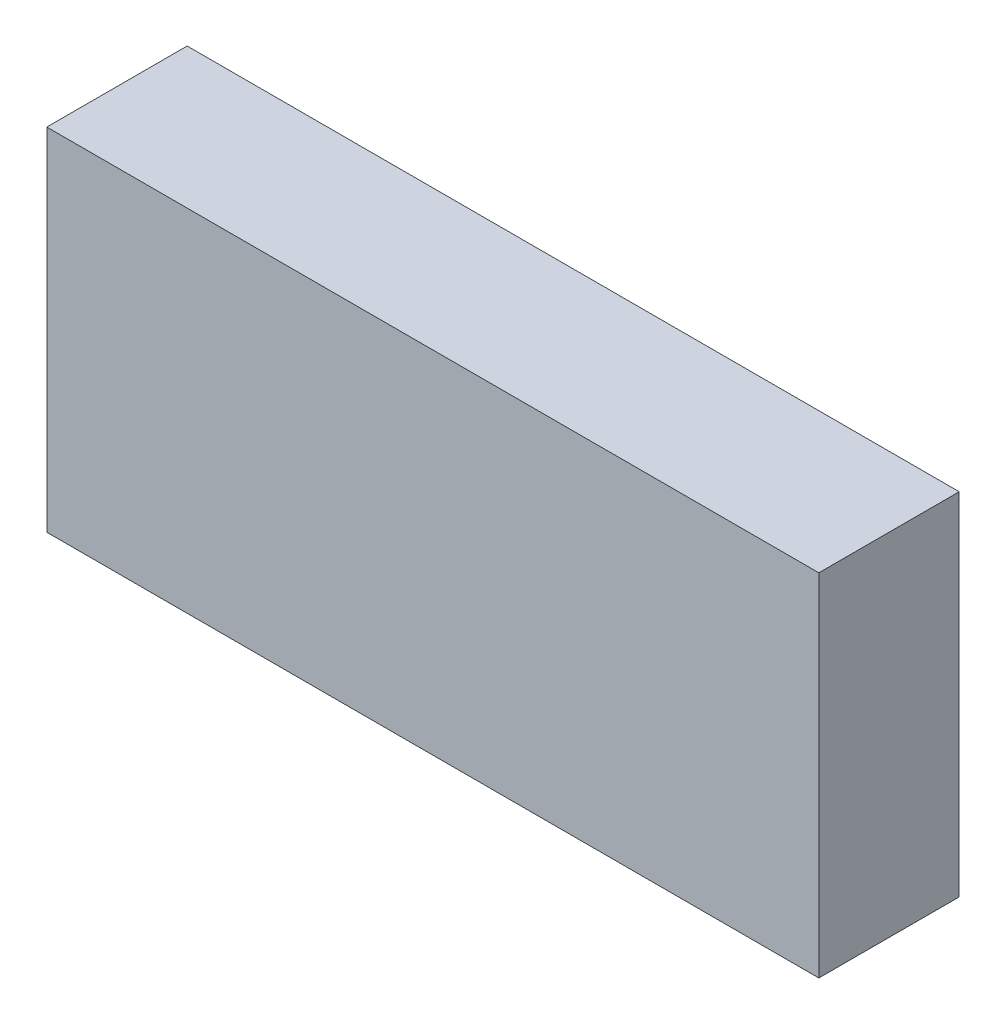
from build123d import *

# Parameters (mm, degrees)
SKETCH1_W                       = 39
SKETCH1_H                       = 155
BOSS_EXTRUDE1_DEPTH             = 2
BOSS_EXTRUDE2_DEPTH             = 38
SKETCH3_W                       = 2
SKETCH3_H                       = 2
BOSS_EXTRUDE3_DEPTH             = 38
SKETCH4_W                       = 2
SKETCH4_H                       = 2
BOSS_EXTRUDE4_DEPTH             = 151
SKETCH6_W                       = 35
SKETCH6_H                       = 2.2
CUT_EXTRUDE1_DEPTH              = 160.340045186
SKETCH7_W                       = 35
SKETCH7_H                       = 2.2
CUT_EXTRUDE2_DEPTH              = 89.490112442
SKETCH5_W                       = 31
SKETCH5_H                       = 2
BOSS_EXTRUDE5_DEPTH             = 2
BOSS_EXTRUDE6_REACH             = 91.367
SKETCH8_W                       = 2
SKETCH8_H                       = 2
BOSS_EXTRUDE6_DIRECTION_2_REACH = 91.367
SKETCH10_W                      = 2
SKETCH10_H                      = 2.2
SKETCH10_W_2                    = 2.2
SKETCH10_H_2                    = 2
BOSS_EXTRUDE8_DEPTH             = 2
SKETCH11_W                      = 2
SKETCH11_H                      = 2.2
SKETCH11_W_2                    = 2.2
SKETCH11_H_2                    = 2
BOSS_EXTRUDE9_DEPTH             = 2
FILLET2_R                       = 2.5
SKETCH14_W                      = 36.5
SKETCH14_H                      = 7.75
BOSS_EXTRUDE10_DEPTH            = 2
SKETCH13_W                      = 31
SKETCH13_H                      = 3
CUT_EXTRUDE4_DEPTH              = 2
FILLET3_R                       = 2
FILLET4_R                       = 0.5
SKETCH15_R                      = 5.1
CUT_EXTRUDE5_DEPTH              = 90.367219941
SKETCH16_R                      = 7.1
BOSS_EXTRUDE11_DEPTH            = 1
FILLET5_R                       = 0.5
FILLET7_R                       = 0.5
CUT_EXTRUDE6_DEPTH              = 6
SKETCH18_W                      = 29
SKETCH18_H                      = 3
CUT_EXTRUDE8_DEPTH              = 90.367219986
CUT_EXTRUDE11_DEPTH             = 90.367219986
CUT_EXTRUDE11_DEPTH_BACK        = 90.367219986
SKETCH20_W                      = 5
SKETCH20_H                      = 40
SKETCH21_W                      = 9
SKETCH21_H                      = 31
CUT_EXTRUDE12_DEPTH             = 89.41097217
CUT_EXTRUDE13_DEPTH             = 41.425858061
CUT_EXTRUDE13_DEPTH_BACK        = 41.425858061
SKETCH22_W                      = 11
SKETCH22_H                      = 8.2
SKETCH23_W                      = 11
SKETCH23_H                      = 17.8
CUT_EXTRUDE14_DEPTH             = 33.334037793


with BuildPart() as part:
    # Sketch1 → Boss-Extrude1 (new body)
    with BuildSketch(Plane(origin=(0, 0, 0), x_dir=(1, 0, 0), z_dir=(0, 1, 0))):
        Rectangle(SKETCH1_W, SKETCH1_H)
    extrude(amount=BOSS_EXTRUDE1_DEPTH)

    # Sketch2 → Boss-Extrude2 (add)
    with BuildSketch(Plane(origin=(0, 2, 0), x_dir=(1, 0, 0), z_dir=(0, 1, 0))):
        Polygon((-17.5, -77.5), (-17.5, -75.5), (-17.5, 75.5), (17.5, 75.5), (17.5, -75.5), (17.5, -77.5), (19.5, -77.5), (19.5, 77.5), (-19.5, 77.5), (-19.5, -77.5), align=None)
    extrude(amount=BOSS_EXTRUDE2_DEPTH)

    # Sketch3 → Boss-Extrude3 (add)
    with BuildSketch(Plane(origin=(0, 2, 0), x_dir=(1, 0, 0), z_dir=(0, 1, 0))):
        with Locations((-16.5, -76.5)):
            Rectangle(SKETCH3_W, SKETCH3_H)
        with Locations((-16.5, -72.3)):
            Rectangle(SKETCH3_W, SKETCH3_H)
        with Locations((16.5, -76.5)):
            Rectangle(SKETCH3_W, SKETCH3_H)
        with Locations((16.5, -72.3)):
            Rectangle(SKETCH3_W, SKETCH3_H)
    extrude(amount=BOSS_EXTRUDE3_DEPTH)

    # Sketch4 → Boss-Extrude4 (add)
    with BuildSketch(Plane.XY.offset(-75.5)):
        with Locations((-16.5, 39)):
            Rectangle(SKETCH4_W, SKETCH4_H)
        Polygon((-15.5, 33.8), (-17.5, 31.8), (-17.5, 35.8), (-15.5, 35.8), align=None)
        Polygon((15.5, 35.8), (17.5, 35.8), (17.5, 31.8), (15.5, 33.8), align=None)
        with Locations((16.5, 39)):
            Rectangle(SKETCH4_W, SKETCH4_H)
    extrude(amount=BOSS_EXTRUDE4_DEPTH)

    # Sketch6 → Cut-Extrude1 (cut, through all)
    with BuildSketch(Plane.XY.offset(-75.5)):
        with Locations((0, 36.9)):
            Rectangle(SKETCH6_W, SKETCH6_H)
    extrude(amount=CUT_EXTRUDE1_DEPTH, mode=Mode.SUBTRACT)

    # Sketch7 → Cut-Extrude2 (cut, through all)
    with BuildSketch(Plane(origin=(0, 2, 0), x_dir=(1, 0, 0), z_dir=(0, 1, 0))):
        with Locations((0, -74.4)):
            Rectangle(SKETCH7_W, SKETCH7_H)
    extrude(amount=CUT_EXTRUDE2_DEPTH, mode=Mode.SUBTRACT)

    # Sketch5 → Boss-Extrude5 (add)
    with BuildSketch(Plane(origin=(0, 2, 0), x_dir=(1, 0, 0), z_dir=(0, 1, 0))):
        with Locations((0, -76.5)):
            Rectangle(SKETCH5_W, SKETCH5_H)
        with Locations((0, -72.3)):
            Rectangle(SKETCH5_W, SKETCH5_H)
    extrude(amount=BOSS_EXTRUDE5_DEPTH)

    # Boss-Extrude6: up to this face of the body (flat: up to its plane)
    boss_extrude6_end = Plane(part.part.faces().sort_by_distance((17.5, 16.9, -2.1))[0])
    # Sketch8 → Boss-Extrude6 (add, up to the picked face)
    with BuildSketch(Plane(origin=(0, 0, 0), x_dir=(0, 0, -1), z_dir=(1, 0, 0)), mode=Mode.PRIVATE) as boss_extrude6_sk1:
        with Locations((74.5, 39)):
            Rectangle(SKETCH8_W, SKETCH8_H)
    boss_extrude6_tool1 = split(extrude(boss_extrude6_sk1.sketch, amount=BOSS_EXTRUDE6_REACH, mode=Mode.PRIVATE), bisect_by=boss_extrude6_end, keep=Keep.BOTH, mode=Mode.PRIVATE)
    # Sketch8 → Boss-Extrude6 (add, up to the picked face)
    with BuildSketch(Plane(origin=(0, 0, 0), x_dir=(0, 0, -1), z_dir=(1, 0, 0)), mode=Mode.PRIVATE) as boss_extrude6_sk2:
        Polygon((75.5, 35.8), (73.5, 35.8), (73.5, 33.8), (75.5, 31.8), align=None)
    boss_extrude6_tool2 = split(extrude(boss_extrude6_sk2.sketch, amount=BOSS_EXTRUDE6_REACH, mode=Mode.PRIVATE), bisect_by=boss_extrude6_end, keep=Keep.BOTH, mode=Mode.PRIVATE)
    add(boss_extrude6_tool1.solids().sort_by(Axis((0, 39, -74.5), (1, 0, 0)))[0])
    add(boss_extrude6_tool2.solids().sort_by(Axis((0, 34.244444, -74.611111), (1, 0, 0)))[0])

    # Boss-Extrude6 direction 2: up to this face of the body (flat: up to its plane)
    boss_extrude6_direction_2_end = Plane(part.part.faces().sort_by_distance((-17.5, 16.9, -2.1))[0])
    # Sketch8 → Boss-Extrude6 direction 2 (add, up to the picked face)
    with BuildSketch(Plane(origin=(0, 0, 0), x_dir=(0, 0, -1), z_dir=(1, 0, 0)), mode=Mode.PRIVATE) as boss_extrude6_direction_2_sk1:
        with Locations((74.5, 39)):
            Rectangle(SKETCH8_W, SKETCH8_H)
    boss_extrude6_direction_2_tool1 = split(extrude(boss_extrude6_direction_2_sk1.sketch, amount=-BOSS_EXTRUDE6_DIRECTION_2_REACH, mode=Mode.PRIVATE), bisect_by=boss_extrude6_direction_2_end, keep=Keep.BOTH, mode=Mode.PRIVATE)
    # Sketch8 → Boss-Extrude6 direction 2 (add, up to the picked face)
    with BuildSketch(Plane(origin=(0, 0, 0), x_dir=(0, 0, -1), z_dir=(1, 0, 0)), mode=Mode.PRIVATE) as boss_extrude6_direction_2_sk2:
        Polygon((75.5, 35.8), (73.5, 35.8), (73.5, 33.8), (75.5, 31.8), align=None)
    boss_extrude6_direction_2_tool2 = split(extrude(boss_extrude6_direction_2_sk2.sketch, amount=-BOSS_EXTRUDE6_DIRECTION_2_REACH, mode=Mode.PRIVATE), bisect_by=boss_extrude6_direction_2_end, keep=Keep.BOTH, mode=Mode.PRIVATE)
    add(boss_extrude6_direction_2_tool1.solids().sort_by(Axis((0, 39, -74.5), (-1, 0, 0)))[0])
    add(boss_extrude6_direction_2_tool2.solids().sort_by(Axis((0, 34.244444, -74.611111), (-1, 0, 0)))[0])

    # Sketch10 → Boss-Extrude8 (add)
    with BuildSketch(Plane(origin=(-17.5, 0, 0), x_dir=(0, 0, -1), z_dir=(1, 0, 0))):
        with Locations((-76.5, 36.9)):
            Rectangle(SKETCH10_W, SKETCH10_H)
        with Locations((-74.4, 39)):
            Rectangle(SKETCH10_W_2, SKETCH10_H_2)
    extrude(amount=BOSS_EXTRUDE8_DEPTH)

    # Sketch11 → Boss-Extrude9 (add)
    with BuildSketch(Plane.ZY.offset(-17.5)):
        with Locations((76.5, 36.9)):
            Rectangle(SKETCH11_W, SKETCH11_H)
        with Locations((74.4, 39)):
            Rectangle(SKETCH11_W_2, SKETCH11_H_2)
    extrude(amount=BOSS_EXTRUDE9_DEPTH)

    # Fillet2
    fillet2_edges = [part.edges().sort_by_distance(p)[0] for p in [
        (-17.5, 16.9, 71.3),
        (17.5, 16.9, 71.3),
        (19.5, 20, 77.5),
        (-19.5, 20, 77.5),
        (-19.5, 20, -77.5),
        (-17.5, 16.9, -75.5),
        (17.5, 16.9, -75.5),
        (19.5, 20, -77.5),
        (19.5, 40, 0),
        (-19.5, 40, 0),
        (19.5, 0, 0),
        (-19.5, 0, 0),
        (0, 40, -77.5),
        (0, 0, 77.5),
        (0, 0, -77.5),
        (-17.5, 40, 77.5),
        (17.5, 40, 77.5),
    ]]
    fillet(fillet2_edges, radius=FILLET2_R)

    # Sketch14 → Boss-Extrude10 (add)
    with BuildSketch(Plane.XY.offset(-75.5)):
        with Locations((0, 5.125)):
            Rectangle(SKETCH14_W, SKETCH14_H)
    extrude(amount=BOSS_EXTRUDE10_DEPTH)

    # Sketch13 → Cut-Extrude4 (cut)
    with BuildSketch(Plane(origin=(0, 0, -77.5), x_dir=(-1, 0, 0), z_dir=(0, 0, -1))):
        with Locations((0, 5.5)):
            Rectangle(SKETCH13_W, SKETCH13_H)
    extrude(amount=-CUT_EXTRUDE4_DEPTH, mode=Mode.SUBTRACT)

    # Fillet3
    fillet3_edges = [part.edges().sort_by_distance(p)[0] for p in [
        (0, 9, -73.5),
    ]]
    fillet(fillet3_edges, radius=FILLET3_R - 0.0001)  # a hair under: the kernel refuses the full size

    # Fillet4
    fillet4_edges = [part.edges().sort_by_distance(p)[0] for p in [
        (15.5, 5.5, -75.5),
        (15.5, 4, -76.5),
        (0, 7, -75.5),
        (15.5, 7, -76.5),
        (-15.5, 5.5, -75.5),
        (-15.5, 7, -76.5),
        (0, 4, -75.5),
        (-15.5, 4, -76.5),
        (15.5, 5.5, -77.5),
        (0, 4, -77.5),
        (-15.5, 5.5, -77.5),
        (0, 7, -77.5),
    ]]
    fillet(fillet4_edges, radius=FILLET4_R)

    # Sketch15 → Cut-Extrude5 (cut, through all)
    with BuildSketch(Plane.XZ):
        with Locations(Location((0, 38.75, 0), (0, 0, 270))):
            Circle(SKETCH15_R)
        with Locations(Location((0, -38.75, 0), (0, 0, 270))):
            Circle(SKETCH15_R)
    extrude(amount=-CUT_EXTRUDE5_DEPTH, mode=Mode.SUBTRACT)

    # Sketch16 → Boss-Extrude11 (add)
    with BuildSketch(Plane(origin=(0, 2, 0), x_dir=(1, 0, 0), z_dir=(0, 1, 0))):
        with Locations(Location((0, 38.75, 0), (0, 0, 270))):
            Circle(SKETCH16_R)
        with Locations(Location((0, -38.75, 0), (0, 0, 270))):
            Circle(SKETCH16_R)
    extrude(amount=BOSS_EXTRUDE11_DEPTH)

    # Fillet5
    fillet5_edges = [part.edges().sort_by_distance(p)[0] for p in [
        (0, 2, -45.85),
        (0, 3, -45.85),
        (0, 2, 31.65),
        (0, 3, 31.65),
    ]]
    fillet(fillet5_edges, radius=FILLET5_R - 0.0001)  # a hair under: the kernel refuses the full size

    # Fillet7
    fillet7_edges = [part.edges().sort_by_distance(p)[0] for p in [
        (15.5, 40, 0.75),
        (0, 4, 77.5),
        (0, 40, -73.5),
        (-15.5, 40, 0.75),
        (-15.5, 20.75, 77.5),
        (-15.5, 39.267766953, 76.767766953),
        (15.5, 20.75, 77.5),
        (15.5, 39.267766953, 76.767766953),
    ]]
    fillet(fillet7_edges, radius=FILLET7_R)

    # Sketch17 → Cut-Extrude6 (cut)
    with BuildSketch(Plane.XZ):
        Polygon((-17, -77.5), (-17, 70.299999999), (-14.999999999, 71.3), (-14.999999999, 77.5), (14.999999999, 77.5), (14.999999999, 71.3), (17, 70.299999999), (17, -77.5), align=None)
    extrude(amount=-CUT_EXTRUDE6_DEPTH, mode=Mode.SUBTRACT)

    # Sketch18 → Cut-Extrude8 (cut, through all)
    with BuildSketch(Plane.XY):
        with Locations((0, 7.5)):
            Rectangle(SKETCH18_W, SKETCH18_H)
    extrude(amount=-CUT_EXTRUDE8_DEPTH, mode=Mode.SUBTRACT)

    # Sketch20 → Cut-Extrude11 (cut, two sides: drawn at the far end of the back side and taken through both)
    with BuildSketch(Plane.XY.offset(-CUT_EXTRUDE11_DEPTH_BACK)):
        Polygon((19.5, 40), (14.5, 40), (14.5, 6), (14.5, 0), (19.5, 0), align=None)
        with Locations((-17, 20)):
            Rectangle(SKETCH20_W, SKETCH20_H)
    extrude(amount=CUT_EXTRUDE11_DEPTH + CUT_EXTRUDE11_DEPTH_BACK, mode=Mode.SUBTRACT)

    # Sketch21 → Cut-Extrude12 (cut, through all)
    with BuildSketch(Plane.XY):
        with Locations((-10, 24.5)):
            Rectangle(SKETCH21_W, SKETCH21_H)
        with Locations((10, 24.5)):
            Rectangle(SKETCH21_W, SKETCH21_H)
    extrude(amount=-CUT_EXTRUDE12_DEPTH, mode=Mode.SUBTRACT)

    # Sketch22 → Cut-Extrude13 (cut, two sides: drawn at the far end of the back side and taken through both)
    with BuildSketch(Plane.XY.offset(-75.5).offset(-CUT_EXTRUDE13_DEPTH_BACK)):
        with Locations((0, 35.9)):
            Rectangle(SKETCH22_W, SKETCH22_H)
    extrude(amount=CUT_EXTRUDE13_DEPTH + CUT_EXTRUDE13_DEPTH_BACK, mode=Mode.SUBTRACT)

    # Sketch23 → Cut-Extrude14 (cut, through all)
    with BuildSketch(Plane.XY.offset(-75.5)):
        with Locations((0, 17.9)):
            Rectangle(SKETCH23_W, SKETCH23_H)
    extrude(amount=-CUT_EXTRUDE14_DEPTH, mode=Mode.SUBTRACT)


solid = part.part
